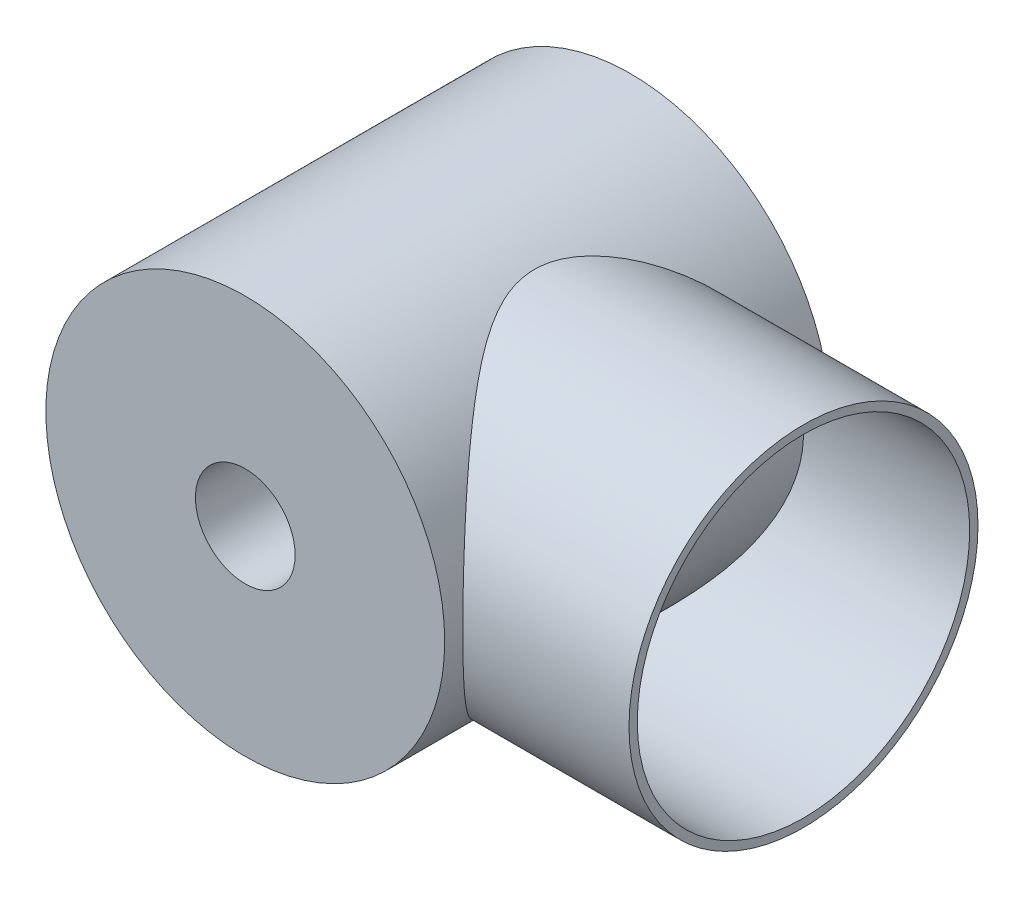
from build123d import *

# Parameters (mm, degrees)
SKETCH1_R           = 12
BOSS_EXTRUDE1_DEPTH = 11.59
SKETCH3_R           = 10.5
SKETCH3_R_2         = 10
EXTRUDE_THIN1_DEPTH = 22
SHELL1_START        = -11.59
SHELL1_OUTLINE_R    = 7.5
SHELL1_DEPTH        = 18.68
CUT_EXTRUDE1_REACH  = 36.137
SKETCH4_R           = 3


# Read off the part's stored shape, not the designer's step: Shell1
with BuildPart() as part:
    # Sketch1 → Boss-Extrude1 (new, symmetric)
    with BuildSketch(Plane.XY):
        Circle(SKETCH1_R)
    extrude(amount=BOSS_EXTRUDE1_DEPTH, both=True)

    # Sketch3 → Extrude-Thin1 (add)
    with BuildSketch(Plane(origin=(0, 0, 0), x_dir=(0, 0, -1), z_dir=(1, 0, 0))):
        Circle(SKETCH3_R)
        Circle(SKETCH3_R_2, mode=Mode.SUBTRACT)
    extrude(amount=EXTRUDE_THIN1_DEPTH)

    # Shell1 outline → Shell1 (cut)
    with BuildSketch(Plane.XY.offset(SHELL1_START)):
        Circle(SHELL1_OUTLINE_R)
    extrude(amount=SHELL1_DEPTH, mode=Mode.SUBTRACT)

    # Sketch4 → Cut-Extrude1 (cut, up to next)
    with BuildSketch(Plane.XY.offset(11.59), mode=Mode.PRIVATE) as cut_extrude1_sk1:
        Circle(SKETCH4_R)
    cut_extrude1_tool1 = extrude(cut_extrude1_sk1.sketch, amount=-CUT_EXTRUDE1_REACH, mode=Mode.PRIVATE) & part.part
    add(cut_extrude1_tool1.solids().sort_by_distance((0, 0, 11.59))[0], mode=Mode.SUBTRACT)


solid = part.part
